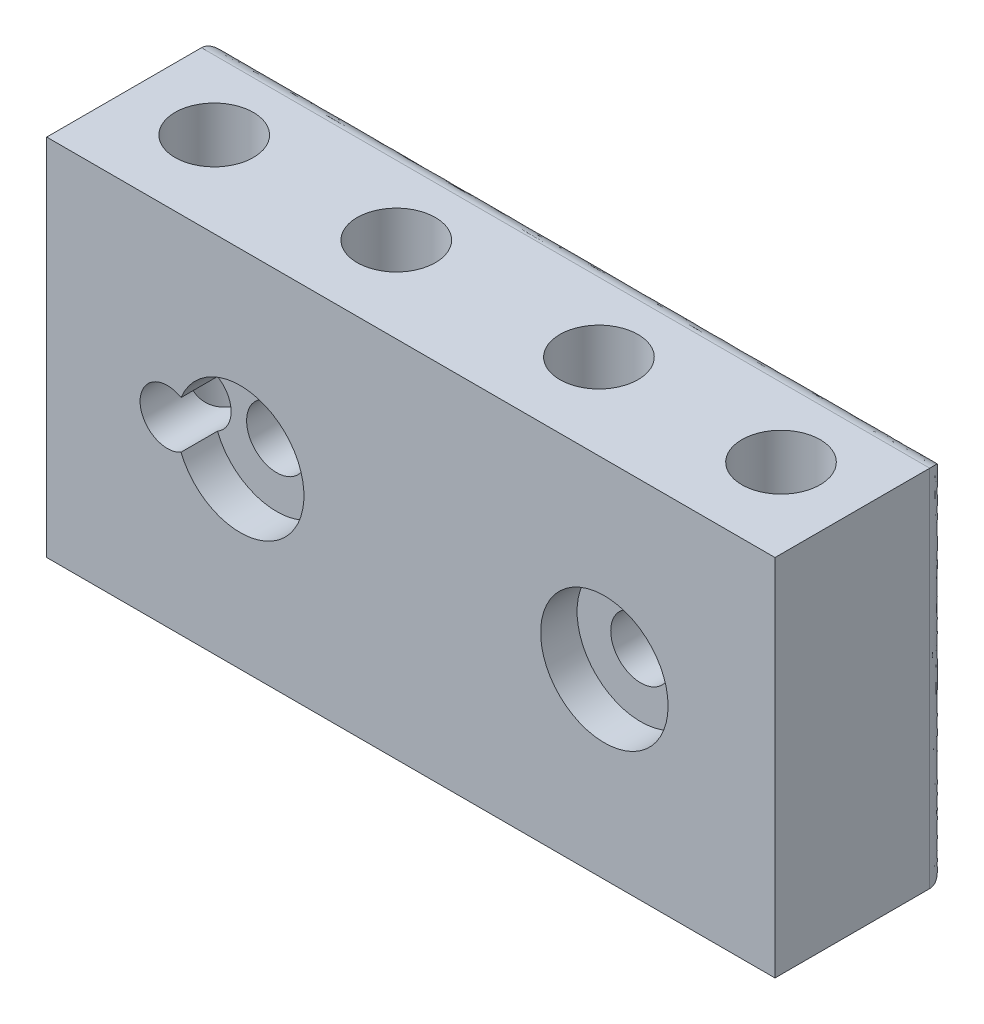
from build123d import *

# Parameters (mm, degrees)
SKETCH1_W           = 40
SKETCH1_H           = 20
BOSS_EXTRUDE1_DEPTH = 9.5
CUT_EXTRUDE1_DEPTH  = 2
FILLET1_R           = 1
SKETCH4_R           = 2.15
CUT_EXTRUDE2_DEPTH  = 30.837057496
SKETCH5_R           = 1.5
SKETCH5_R_2         = 1.65
CUT_EXTRUDE3_DEPTH  = 25.295061227
SKETCH6_R           = 3.5
CUT_EXTRUDE4_DEPTH  = 2


with BuildPart() as part:
    # Sketch1 → Boss-Extrude1 (new body)
    with BuildSketch(Plane.XY):
        Rectangle(SKETCH1_W, SKETCH1_H)
    extrude(amount=BOSS_EXTRUDE1_DEPTH)

    # Sketch3 → Cut-Extrude1 (cut)
    with BuildSketch(Plane(origin=(0, 0, 0), x_dir=(-1, 0, 0), z_dir=(0, 0, -1))):
        with BuildLine():
            Line((13.371397425, -3.45), (1.371397425, -3.45))
            add(Edge.make_bspline(
                [(-6.426606991, -6.332711355), (-3.012827406, -3.55467535), (1.371397425, -3.45)],
                knots=[0, 0, 0, 1, 1, 1], degree=2))
            ThreePointArc((-6.426606991, -6.332711355), (-18.228602575, 0), (-6.426606991, 6.332711355))
            add(Edge.make_bspline(
                [(-6.426606991, 6.332711355), (-3.012827406, 3.55467535), (1.371397425, 3.45)],
                knots=[0, 0, 0, 1, 1, 1], degree=2))
            Line((1.371397425, 3.45), (13.371397425, 3.45))
            ThreePointArc((13.371397425, 3.45), (16.821397425, 0), (13.371397425, -3.45))
        make_face()
    extrude(amount=-CUT_EXTRUDE1_DEPTH, mode=Mode.SUBTRACT)

    # Fillet1
    fillet1_edges = [part.edges().sort_by_distance(p)[0] for p in [
        (-20, 0, 0),
        (0, -10, 0),
        (0, 10, 0),
        (20, 0, 0),
    ]]
    fillet(fillet1_edges, radius=FILLET1_R)

    # Sketch4 → Cut-Extrude2 (cut, through all)
    with BuildSketch(Plane(origin=(0, 10, 0), x_dir=(1, 0, 0), z_dir=(0, 1, 0))):
        with Locations((-15.5, -4.8)):
            Circle(SKETCH4_R)
        with Locations((-5.5, -4.8)):
            Circle(SKETCH4_R)
        with Locations((5.63, -4.8)):
            Circle(SKETCH4_R)
        with Locations((15.63, -4.8)):
            Circle(SKETCH4_R)
    extrude(amount=-CUT_EXTRUDE2_DEPTH, mode=Mode.SUBTRACT)

    # Sketch5 → Cut-Extrude3 (cut, through all)
    with BuildSketch(Plane(origin=(0, 0, 0), x_dir=(-1, 0, 0), z_dir=(0, 0, -1))):
        with Locations((13.371397425, 0)):
            Circle(SKETCH5_R)
        with Locations((9.371397425, 0)):
            Circle(SKETCH5_R_2)
        with Locations((-10.628602575, 0)):
            Circle(SKETCH5_R_2)
    extrude(amount=-CUT_EXTRUDE3_DEPTH, mode=Mode.SUBTRACT)

    # Sketch6 → Cut-Extrude4 (cut)
    with BuildSketch(Plane.XY.offset(9.5)):
        with Locations((10.628602575, 0)):
            Circle(SKETCH6_R)
        with Locations((-9.371397425, 0)):
            Circle(SKETCH6_R)
    extrude(amount=-CUT_EXTRUDE4_DEPTH, mode=Mode.SUBTRACT)


solid = part.part
